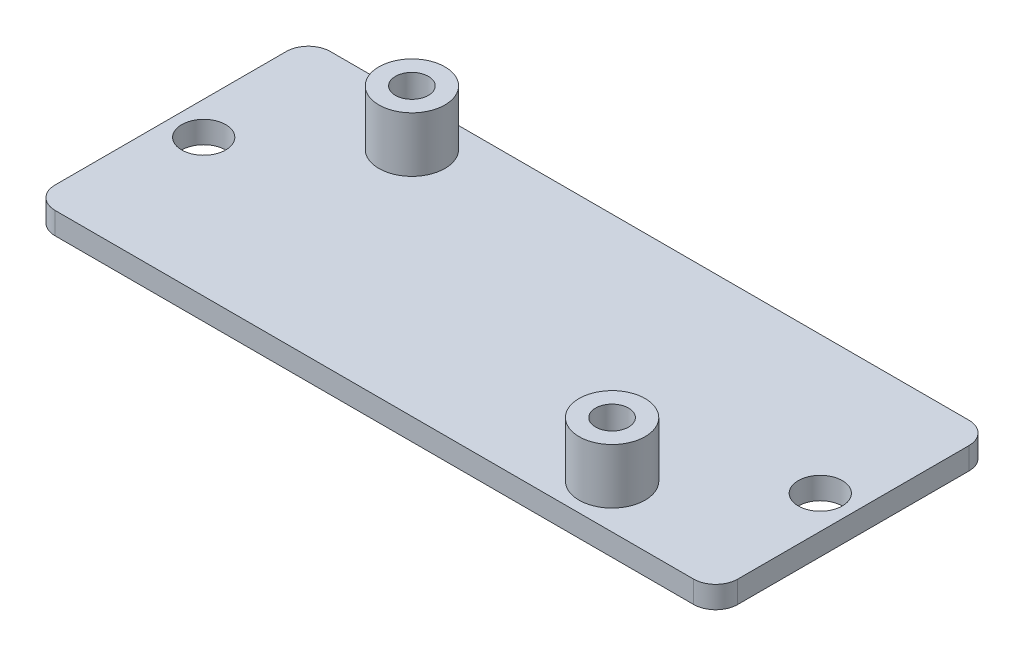
from build123d import *

# Parameters (mm, degrees)
SKETCH_1_W               = 62
SKETCH_1_H               = 25
EXTRUDE_1_DEPTH          = 2
SKETCH_2_R               = 3
EXTRUDE_2_DEPTH          = 5
CUT_EXTRUDE_1_DEPTH      = 68.216069507
CUT_EXTRUDE_1_DEPTH_BACK = 68.216069507
SKETCH_3_R               = 1.5
CUT_EXTRUDE_2_DEPTH      = 68.037303048
CUT_EXTRUDE_2_DEPTH_BACK = 68.037303048
SKETCH_4_R               = 2
FILLET_1_R               = 2
FILLET_2_R               = 2
FILLET_3_R               = 2
FILLET_4_R               = 2


with BuildPart() as part:
    # Эскиз1 → Бобышка-Вытянуть1 (new body)
    with BuildSketch(Plane(origin=(0, 0, 0), x_dir=(1, 0, 0), z_dir=(0, 1, 0))):
        with Locations((31, -12.5)):
            Rectangle(SKETCH_1_W, SKETCH_1_H)
    extrude(amount=EXTRUDE_1_DEPTH)

    # Эскиз2 → Бобышка-Вытянуть2 (add)
    with BuildSketch(Plane(origin=(0, 2, 0), x_dir=(1, 0, 0), z_dir=(0, 1, 0))):
        with Locations((13.41, -4)):
            Circle(SKETCH_2_R)
        with Locations((48.59, -21)):
            Circle(SKETCH_2_R)
    extrude(amount=EXTRUDE_2_DEPTH)

    # Эскиз3 → Вырез-Вытянуть1 (cut, two sides: drawn at the far end of the back side and taken through both)
    with BuildSketch(Plane(origin=(0, 7, 0), x_dir=(1, 0, 0), z_dir=(0, 1, 0)).offset(-CUT_EXTRUDE_1_DEPTH_BACK)):
        with Locations((13.41, -4)):
            Circle(SKETCH_3_R)
        with Locations((48.59, -21)):
            Circle(SKETCH_3_R)
    extrude(amount=CUT_EXTRUDE_1_DEPTH + CUT_EXTRUDE_1_DEPTH_BACK, mode=Mode.SUBTRACT)

    # Эскиз4 → Вырез-Вытянуть2 (cut, two sides: drawn at the far end of the back side and taken through both)
    with BuildSketch(Plane(origin=(0, 2, 0), x_dir=(1, 0, 0), z_dir=(0, 1, 0)).offset(-CUT_EXTRUDE_2_DEPTH_BACK)):
        with Locations((3, -12.5)):
            Circle(SKETCH_4_R)
        with Locations((59, -12.5)):
            Circle(SKETCH_4_R)
    extrude(amount=CUT_EXTRUDE_2_DEPTH + CUT_EXTRUDE_2_DEPTH_BACK, mode=Mode.SUBTRACT)

    # Скругление1
    fillet_1_edges = [part.edges().sort_by_distance(p)[0] for p in [
        (0, 1, 0),
    ]]
    fillet(fillet_1_edges, radius=FILLET_1_R)

    # Скругление2
    fillet_2_edges = [part.edges().sort_by_distance(p)[0] for p in [
        (0, 1, 25),
    ]]
    fillet(fillet_2_edges, radius=FILLET_2_R)

    # Скругление3
    fillet_3_edges = [part.edges().sort_by_distance(p)[0] for p in [
        (62, 1, 25),
    ]]
    fillet(fillet_3_edges, radius=FILLET_3_R)

    # Скругление4
    fillet_4_edges = [part.edges().sort_by_distance(p)[0] for p in [
        (62, 1, 0),
    ]]
    fillet(fillet_4_edges, radius=FILLET_4_R)


solid = part.part
